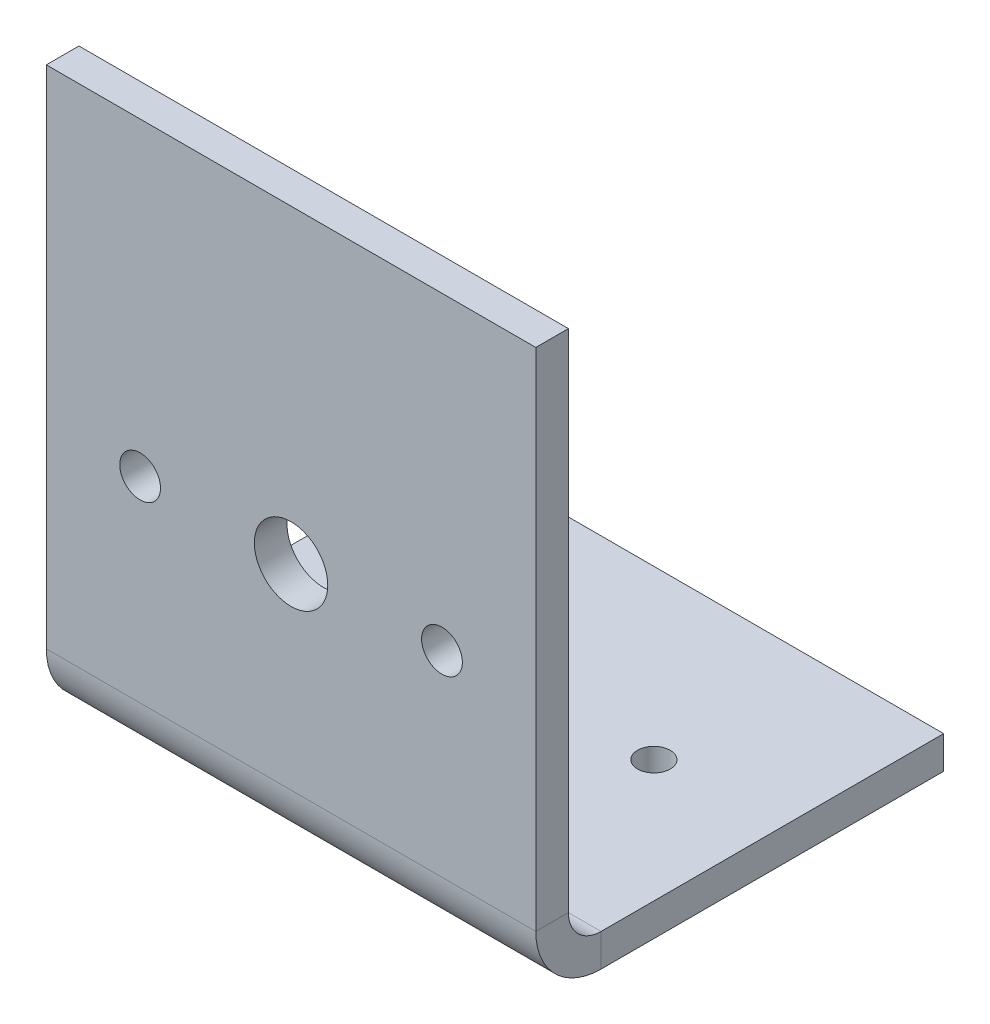
from build123d import *

# Parameters (mm, degrees)
BOSS_EXTRUDE1_DEPTH    = 60
CONVERT_SOLID1_DEPTH   = 60
CONVERT_SOLID1_2_DEPTH = 60
SKETCH7_R              = 2
CUT_EXTRUDE2_DEPTH     = 60
SKETCH10_R             = 4.5
CUT_EXTRUDE3_DEPTH     = 10
SKETCH12_R             = 2.5
CUT_EXTRUDE4_DEPTH     = 10


# Read off the part's stored shape, not the designer's step: Convert-Solid1
with BuildPart() as part:
    # Sketch2 → Boss-Extrude1 (new body)
    with BuildSketch(Plane(origin=(0, 0, 0), x_dir=(0, 0, -1), z_dir=(1, 0, 0))):
        Polygon((0, 70), (0, 0), (50, 0), (50, 4), (4, 4), (4, 70), align=None)
    extrude(amount=BOSS_EXTRUDE1_DEPTH)

    # Convert-Solid1 outline → Convert-Solid1 (cut)
    with BuildSketch(Plane.YZ):
        with BuildLine():
            ThreePointArc((0, -8), (2.343145751, -2.343145751), (8, 0))
            Line((8, 0), (0, 0))
            Line((0, 0), (0, -8))
        make_face()
    extrude(amount=CONVERT_SOLID1_DEPTH, mode=Mode.SUBTRACT)

    # Convert-Solid1 2 outline → Convert-Solid1 2 (add)
    with BuildSketch(Plane.YZ):
        with BuildLine():
            ThreePointArc((4, -8), (5.171572875, -5.171572875), (8, -4))
            Line((8, -4), (4, -4))
            Line((4, -4), (4, -8))
        make_face()
    extrude(amount=CONVERT_SOLID1_2_DEPTH)

    # Sketch7 → Cut-Extrude2 (cut)
    with BuildSketch(Plane(origin=(0, 4, 0), x_dir=(1, 0, 0), z_dir=(0, 1, 0))):
        with Locations(Location((15, 29.476677551, 0), (0, 0, 270))):
            Circle(SKETCH7_R)
    cut_extrude2 = extrude(amount=-CUT_EXTRUDE2_DEPTH, mode=Mode.SUBTRACT)

    # Mirror1: Cut-Extrude2 across plane
    add(cut_extrude2.mirror(Plane.ZY.offset(-30)), mode=Mode.SUBTRACT)

    # Sketch10 → Cut-Extrude3 (cut)
    with BuildSketch(Plane(origin=(0, 0, -4), x_dir=(-1, 0, 0), z_dir=(0, 0, -1))):
        with Locations(Location((-30, 32, 0), (0, 0, 90))):
            Circle(SKETCH10_R)
    extrude(amount=-CUT_EXTRUDE3_DEPTH, mode=Mode.SUBTRACT)

    # Sketch12 → Cut-Extrude4 (cut)
    with BuildSketch(Plane(origin=(0, 0, -4), x_dir=(-1, 0, 0), z_dir=(0, 0, -1))):
        with Locations(Location((-48.499902666, 32.060011256, 0), (0, 0, 90))):
            Circle(SKETCH12_R)
        with Locations(Location((-11.5, 32.060011256, 0), (0, 0, 90))):
            Circle(SKETCH12_R)
    extrude(amount=-CUT_EXTRUDE4_DEPTH, mode=Mode.SUBTRACT)


solid = part.part
